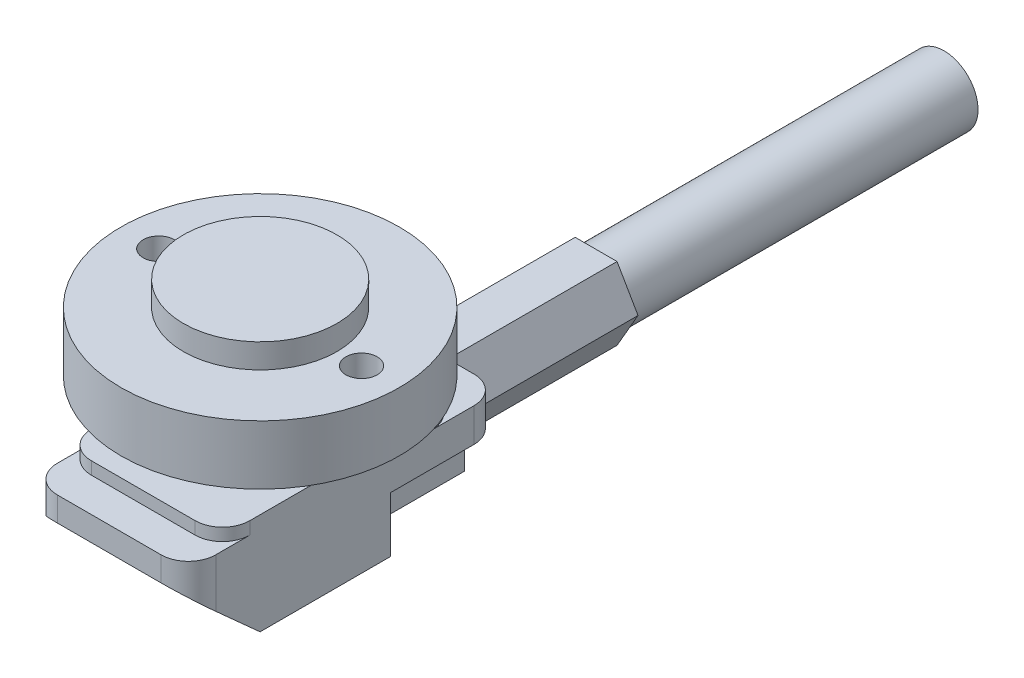
from build123d import *

# Parameters (mm, degrees)
SKETCH1_R                = 5.60705
BOSS_EXTRUDE1_DEPTH      = 1.778
SKETCH2_R                = 10.16
BOSS_EXTRUDE2_DEPTH      = 4.318
SKETCH3_R                = 1.143
CUT_EXTRUDE1_DEPTH       = 3.318
SKETCH4_R                = 5.5626
BOSS_EXTRUDE3_DEPTH      = 3.0099
BOSS_EXTRUDE4_DEPTH      = 5.78485
FILLET1_R                = 2
FILLET2_R                = 2
SKETCH6_W                = 8.0772
SKETCH6_H                = 4.0386
CUT_EXTRUDE2_DEPTH       = 2.6924
CHAMFER1_SIZE            = 2.6924
CHAMFER1_OF_MIRROR2_SIZE = 2.6924
FILLET3_R                = 2
BOSS_EXTRUDE5_DEPTH      = 12.7
SKETCH8_R                = 2.48285
BOSS_EXTRUDE6_DEPTH      = 25.4


with BuildPart() as part:
    # Sketch1 → Boss-Extrude1 (new body)
    with BuildSketch(Plane(origin=(0, 0, 0), x_dir=(1, 0, 0), z_dir=(0, 1, 0))):
        with Locations(Location((0, 0, 0), (0, 0, 270))):
            Circle(SKETCH1_R)
    extrude(amount=-BOSS_EXTRUDE1_DEPTH)

    # Sketch2 → Boss-Extrude2 (add)
    with BuildSketch(Plane.XZ.offset(1.778)):
        with Locations(Location((0, 0, 0), (0, 0, 270))):
            Circle(SKETCH2_R)
    extrude(amount=BOSS_EXTRUDE2_DEPTH)

    # Sketch3 → Cut-Extrude1 (cut)
    with BuildSketch(Plane(origin=(0, -1.778, 0), x_dir=(1, 0, 0), z_dir=(0, 1, 0))):
        with Locations(Location((7.4, 0, 0), (0, 0, 270))):
            Circle(SKETCH3_R)
    cut_extrude1 = extrude(amount=-CUT_EXTRUDE1_DEPTH, mode=Mode.SUBTRACT)

    # Mirror1: Cut-Extrude1 across plane
    add(cut_extrude1.mirror(Plane(origin=(0, 0, 0), x_dir=(0, 0, 1), z_dir=(1, 0, 0))), mode=Mode.SUBTRACT)

    # Sketch4 → Boss-Extrude3 (add)
    with BuildSketch(Plane.XZ.offset(6.096)):
        with Locations(Location((0, 0, 0), (0, 0, 270))):
            Circle(SKETCH4_R)
    extrude(amount=BOSS_EXTRUDE3_DEPTH)

    # Sketch5 → Boss-Extrude4 (add, symmetric)
    with BuildSketch(Plane(origin=(0, 0, 0), x_dir=(0, 0, -1), z_dir=(1, 0, 0))):
        Polygon((-8.5344, -9.1059), (8.7757, -9.1059), (8.7757, -10.0203), (11.8237, -10.0203), (11.8237, -16.51), (-5.7912, -16.51), (-11.0236, -11.7983), (-11.0236, -10.0203), (-8.5344, -10.0203), align=None)
    extrude(amount=BOSS_EXTRUDE4_DEPTH, both=True)

    # Fillet1
    fillet1_edges = [part.edges().sort_by_distance(p)[0] for p in [
        (-5.78485, -9.5631, 8.5344),
        (-5.78485, -9.5631, -8.7757),
        (5.78485, -9.5631, 8.5344),
        (5.78485, -9.5631, -8.7757),
    ]]
    fillet(fillet1_edges, radius=FILLET1_R)

    # Fillet2
    fillet2_edges = [part.edges().sort_by_distance(p)[0] for p in [
        (-5.78485, -10.9093, 11.0236),
        (5.78485, -10.9093, 11.0236),
    ]]
    fillet(fillet2_edges, radius=FILLET2_R)

    # Sketch6 → Cut-Extrude2 (cut)
    with BuildSketch(Plane(origin=(5.78485, 0, 0), x_dir=(0, 0, -1), z_dir=(1, 0, 0))):
        with Locations((7.7851, -14.4907)):
            Rectangle(SKETCH6_W, SKETCH6_H)
    cut_extrude2 = extrude(amount=-CUT_EXTRUDE2_DEPTH, mode=Mode.SUBTRACT)

    # Chamfer1
    chamfer1_edges = [part.edges().sort_by_distance(p)[0] for p in [
        (3.09245, -14.4907, -3.7465),
    ]]
    chamfer(chamfer1_edges, length=CHAMFER1_SIZE - 0.0001)  # a hair under: the kernel refuses the full size

    # Mirror2: Cut-Extrude2 across plane
    add(cut_extrude2.mirror(Plane(origin=(0, 0, 0), x_dir=(0, 0, 1), z_dir=(1, 0, 0))), mode=Mode.SUBTRACT)

    # Chamfer1 of Mirror2
    chamfer1_of_mirror2_edges = [part.edges().sort_by_distance(p)[0] for p in [
        (-3.09245, -14.4907, -3.7465),
    ]]
    chamfer(chamfer1_of_mirror2_edges, length=CHAMFER1_OF_MIRROR2_SIZE - 0.0001)  # a hair under: the kernel refuses the full size

    # Fillet3
    fillet3_edges = [part.edges().sort_by_distance(p)[0] for p in [
        (-5.78485, -11.24585, -11.8237),
        (5.78485, -11.24585, -11.8237),
    ]]
    fillet(fillet3_edges, radius=FILLET3_R)

    # Sketch7 → Boss-Extrude5 (add)
    with BuildSketch(Plane(origin=(0, 0, -11.8237), x_dir=(-1, 0, 0), z_dir=(0, 0, -1))):
        Polygon((1.529978213, -15.681103357), (3.059956427, -13.031103357), (1.529978213, -10.381103357), (-1.529978213, -10.381103357), (-3.059956427, -13.031103357), (-1.529978213, -15.681103357), align=None)
    extrude(amount=BOSS_EXTRUDE5_DEPTH)

    # Sketch8 → Boss-Extrude6 (add)
    with BuildSketch(Plane(origin=(0, 0, -24.5237), x_dir=(-1, 0, 0), z_dir=(0, 0, -1))):
        with Locations((0, -13.007748328)):
            Circle(SKETCH8_R)
    extrude(amount=BOSS_EXTRUDE6_DEPTH)


solid = part.part
